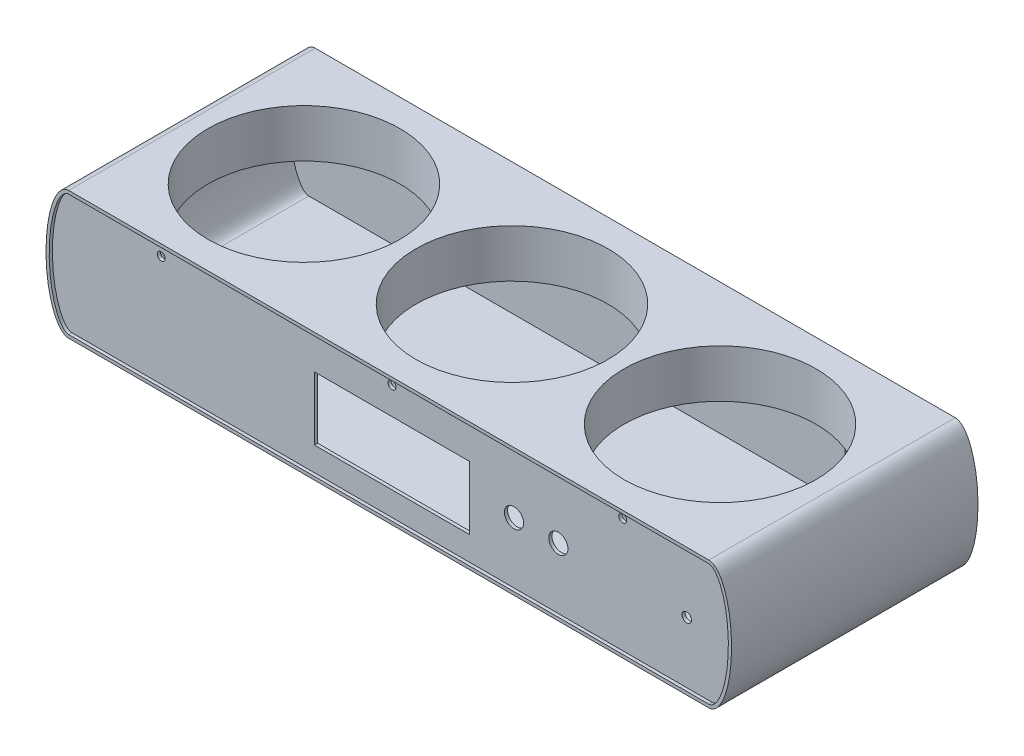
from build123d import *

# Parameters (mm, degrees)
BOSS_EXTRUDE1_DEPTH = 150
SHELL1_START        = -148
SHELL1_DEPTH        = 146
SKETCH2_R           = 6
SKETCH2_R_2         = 2.975
SKETCH2_R_3         = 2.5
SKETCH2_W           = 96.9
SKETCH2_H           = 39.6
CUT_EXTRUDE1_DEPTH  = 45
SKETCH5_R           = 60
CUT_EXTRUDE2_DEPTH  = 20
BOSS_EXTRUDE2_DEPTH = 2
SKETCH8_R           = 5.725
SKETCH8_R_2         = 2.5
SKETCH8_R_3         = 5.9
SKETCH8_W           = 18.5
SKETCH8_H           = 11.65
CUT_EXTRUDE3_DEPTH  = 11
SKETCH11_R          = 62
BOSS_EXTRUDE4_DEPTH = 30
SKETCH13_R          = 60
CUT_EXTRUDE4_DEPTH  = 45


# Read off the part's stored shape, not the designer's step: Shell1
with BuildPart() as part:
    # Sketch1 → Boss-Extrude1 (new body)
    with BuildSketch(Plane.XY):
        with BuildLine():
            Line((-41.816524499, 40.032801891), (358.183475501, 40.032801891))
            add(Edge.make_bspline(
                [(358.183475501, -39.967198109), (372.391507509, -39.967198109), (372.391507509, 0.032801891), (372.391507509, 40.032801891), (358.183475501, 40.032801891)],
                knots=[0, 0, 0, 1.570796327, 1.570796327, 3.141592654, 3.141592654, 3.141592654], degree=2, weights=[1, 0.707106781, 1, 0.707106781, 1]))
            Line((358.183475501, -39.967198109), (-41.816524499, -39.967198109))
            add(Edge.make_bspline(
                [(-41.816524499, 40.032801891), (-56.009616115, 40.032801891), (-56.009616115, 0.032801891), (-56.009616115, -39.967198109), (-41.816524499, -39.967198109)],
                knots=[3.141592654, 3.141592654, 3.141592654, 4.71238898, 4.71238898, 6.283185307, 6.283185307, 6.283185307], degree=2, weights=[1, 0.707106781, 1, 0.707106781, 1]))
        make_face()
    extrude(amount=-BOSS_EXTRUDE1_DEPTH)

    # Shell1 outline → Shell1 (cut)
    with BuildSketch(Plane.XY.offset(SHELL1_START)):
        with BuildLine():
            Line((358.183475501, 38.032801891), (-41.816524499, 38.032801891))
            add(Edge.make_bspline(
                [(-41.816524499, 38.032801891), (-42.29654564, 38.032801891), (-42.776546096, 37.951085494), (-43.280925698, 37.787492415), (-43.832219156, 37.527474208), (-44.444686696, 37.138196586), (-45.071592247, 36.595227373), (-45.720652169, 35.929204369), (-46.370016725, 35.109675392), (-47.015189306, 34.167959998), (-47.648934224, 33.092532674), (-48.265193972, 31.897866168), (-48.859695346, 30.587234727), (-49.428322074, 29.168368378), (-50.507065031, 26.128176752), (-51.017177006, 24.506864975), (-51.494619215, 22.791506954), (-51.936525781, 20.989584017), (-52.340446316, 19.108866555), (-52.704268982, 17.157395109), (-53.026178484, 15.14346074), (-53.304635505, 13.075581705), (-53.538367116, 10.962474671), (-53.726361406, 8.813020108), (-53.867862487, 6.636222674), (-53.96236573, 4.44116883), (-54.009616115, 2.236985115), (-54.009616115, -2.171381333), (-53.96236573, -4.375565048), (-53.867862487, -6.570618892), (-53.726361405, -8.747416326), (-53.538367116, -10.896870889), (-53.304635504, -13.009977923), (-53.026178485, -15.077856959), (-52.704268981, -17.091791327), (-52.340446316, -19.043262773), (-51.936525781, -20.923980234), (-51.494619216, -22.725903172), (-51.017177006, -24.441261193), (-50.507065031, -26.06257297), (-49.428322074, -29.102764596), (-48.859695346, -30.521630946), (-48.265193972, -31.832262386), (-47.648934225, -33.026928892), (-47.015189304, -34.102356215), (-46.370016727, -35.04407161), (-45.720652167, -35.863600586), (-45.071592248, -36.529623591), (-44.444686695, -37.072592804), (-43.832219156, -37.461870426), (-43.280925698, -37.721888633), (-42.776546096, -37.885481712), (-42.29654564, -37.967198109), (-41.816524499, -37.967198109)],
                knots=[3.141592654, 3.141592654, 3.141592654, 3.141592654, 3.141592654, 3.141592654, 3.141592654, 3.141592654, 3.141592654, 3.141592654, 3.141592654, 3.141592654, 3.141592654, 3.141592654, 3.141592654, 3.926990817, 3.926990817, 3.926990817, 3.926990817, 3.926990817, 3.926990817, 3.926990817, 3.926990817, 3.926990817, 3.926990817, 3.926990817, 3.926990817, 3.926990817, 4.71238898, 4.71238898, 4.71238898, 4.71238898, 4.71238898, 4.71238898, 4.71238898, 4.71238898, 4.71238898, 4.71238898, 4.71238898, 4.71238898, 4.71238898, 5.497787144, 5.497787144, 5.497787144, 5.497787144, 5.497787144, 5.497787144, 5.497787144, 5.497787144, 5.497787144, 5.497787144, 5.497787144, 5.497787144, 5.497787144, 6.283185307, 6.283185307, 6.283185307, 6.283185307, 6.283185307, 6.283185307, 6.283185307, 6.283185307, 6.283185307, 6.283185307, 6.283185307, 6.283185307, 6.283185307, 6.283185307, 6.283185307], degree=14))
            Line((-41.816524499, -37.967198109), (358.183475501, -37.967198109))
            add(Edge.make_bspline(
                [(358.183475501, -37.967198109), (358.664667304, -37.967198109), (359.145838532, -37.885368285), (359.651292917, -37.721551252), (360.203481604, -37.461253791), (360.816610656, -37.071839887), (361.444325063, -36.52883648), (362.094001303, -35.862723499), (362.744092434, -35.043248033), (363.389903897, -34.101515507), (364.02430687, -33.026135747), (364.641192661, -31.831501509), (365.236301097, -30.520914046), (365.805508254, -29.102092826), (366.885353654, -26.061994383), (367.395987588, -24.44073051), (367.873919198, -22.725420434), (368.31627955, -20.923544874), (368.720615505, -19.042873973), (369.084812855, -17.091448204), (369.407054219, -15.077558647), (369.68579858, -13.009723628), (369.919771534, -10.89665992), (370.107960052, -8.747248119), (370.249607364, -6.570493024), (370.344208283, -4.375481235), (370.391507509, -2.171339425), (370.391507509, 2.236943207), (370.344208282, 4.441085017), (370.249607366, 6.636096806), (370.107960046, 8.812851901), (369.919771543, 10.962263702), (369.685798567, 13.075327409), (369.407054233, 15.143162429), (369.084812843, 17.157051985), (368.720615514, 19.108477756), (368.316279545, 20.989148655), (367.8739192, 22.791024216), (367.395987587, 24.506334292), (366.885353654, 26.127598165), (365.805508254, 29.167696608), (365.236301097, 30.586517828), (364.641192661, 31.897105291), (364.024306871, 33.091739529), (363.389903896, 34.167119289), (362.744092436, 35.108851814), (362.0940013, 35.928327281), (361.444325066, 36.594440262), (360.816610654, 37.137443669), (360.203481606, 37.526857573), (359.651292916, 37.787155034), (359.145838532, 37.950972067), (358.664667304, 38.032801891), (358.183475501, 38.032801891)],
                knots=[0, 0, 0, 0, 0, 0, 0, 0, 0, 0, 0, 0, 0, 0, 0, 0.785398163, 0.785398163, 0.785398163, 0.785398163, 0.785398163, 0.785398163, 0.785398163, 0.785398163, 0.785398163, 0.785398163, 0.785398163, 0.785398163, 0.785398163, 1.570796327, 1.570796327, 1.570796327, 1.570796327, 1.570796327, 1.570796327, 1.570796327, 1.570796327, 1.570796327, 1.570796327, 1.570796327, 1.570796327, 1.570796327, 2.35619449, 2.35619449, 2.35619449, 2.35619449, 2.35619449, 2.35619449, 2.35619449, 2.35619449, 2.35619449, 2.35619449, 2.35619449, 2.35619449, 2.35619449, 3.141592654, 3.141592654, 3.141592654, 3.141592654, 3.141592654, 3.141592654, 3.141592654, 3.141592654, 3.141592654, 3.141592654, 3.141592654, 3.141592654, 3.141592654, 3.141592654, 3.141592654], degree=14))
        make_face()
    extrude(amount=SHELL1_DEPTH, mode=Mode.SUBTRACT)

    # Sketch2 → Cut-Extrude1 (cut)
    with BuildSketch(Plane.XY):
        with Locations((234.439498222, 0.059436575)):
            Circle(SKETCH2_R)
        with Locations((262.1475136, 0.059436575)):
            Circle(SKETCH2_R)
        with Locations((342.391504359, 0.059436575)):
            Circle(SKETCH2_R_2)
        with Locations((158.183475501, 33.772997638)):
            Circle(SKETCH2_R_3)
        with Locations((302.391504359, 33.772997638)):
            Circle(SKETCH2_R_3)
        with Locations((13.990387032, 31.272997638)):
            Circle(SKETCH2_R_3)
        with Locations((158.190945695, -3.167198109)):
            Rectangle(SKETCH2_W, SKETCH2_H)
    extrude(amount=-CUT_EXTRUDE1_DEPTH, mode=Mode.SUBTRACT)

    # Sketch5 → Cut-Extrude2 (cut)
    with BuildSketch(Plane(origin=(0, 40.032801891, 0), x_dir=(1, 0, 0), z_dir=(0, 1, 0))):
        with Locations(Location((158.183475501, 75, 0), (0, 0, 270))):
            Circle(SKETCH5_R)
        with Locations(Location((28.183475501, 75, 0), (0, 0, 270))):
            Circle(SKETCH5_R)
        with Locations(Location((288.183475501, 75, 0), (0, 0, 270))):
            Circle(SKETCH5_R)
    extrude(amount=-CUT_EXTRUDE2_DEPTH, mode=Mode.SUBTRACT)

    # Sketch7 → Boss-Extrude2 (add)
    with BuildSketch(Plane.XY):
        with BuildLine():
            Line((-41.816524499, 40.032801891), (358.183475501, 40.032801891))
            add(Edge.make_bspline(
                [(358.183475501, -39.967198109), (372.391507509, -39.967198109), (372.391507509, 0.032801891), (372.391507509, 40.032801891), (358.183475501, 40.032801891)],
                knots=[0, 0, 0, 1.570796327, 1.570796327, 3.141592654, 3.141592654, 3.141592654], degree=2, weights=[1, 0.707106781, 1, 0.707106781, 1]))
            Line((358.183475501, -39.967198109), (-41.816524499, -39.967198109))
            add(Edge.make_bspline(
                [(-41.816524499, 40.032801891), (-56.009616115, 40.032801891), (-56.009616115, 0.032801891), (-56.009616115, -39.967198109), (-41.816524499, -39.967198109)],
                knots=[3.141592654, 3.141592654, 3.141592654, 4.71238898, 4.71238898, 6.283185307, 6.283185307, 6.283185307], degree=2, weights=[1, 0.707106781, 1, 0.707106781, 1]))
        make_face()
        with BuildLine():
            Line((-41.816524499, 38.032801891), (358.183475501, 38.032801891))
            add(Edge.make_bspline(
                [(358.183475501, 38.032801891), (358.472329101, 38.032801891), (359.022971599, 37.957413461), (360.27410345, 37.45060729), (362.089990021, 35.945480673), (364.343703734, 32.582811471), (366.40153477, 27.840073609), (368.12274291, 21.942778412), (369.844369693, 12.887615075), (370.756266053, 0.032801891), (369.844369693, -12.822011293), (368.12274291, -21.87717463), (366.40153477, -27.774469827), (364.343703734, -32.517207689), (362.089990021, -35.879876891), (360.27410345, -37.385003508), (359.022971599, -37.891809679), (358.472329101, -37.967198109), (358.183475501, -37.967198109)],
                knots=[0, 0, 0, 0, 0.09817477, 0.196349541, 0.392699082, 0.589048623, 0.785398163, 0.981747704, 1.178097245, 1.570796327, 1.963495408, 2.159844949, 2.35619449, 2.552544031, 2.748893572, 2.945243113, 3.043417883, 3.141592654, 3.141592654, 3.141592654, 3.141592654], degree=3))
            Line((358.183475501, -37.967198109), (-41.816524499, -37.967198109))
            add(Edge.make_bspline(
                [(-41.816524499, -37.967198109), (-42.104715544, -37.967198109), (-42.653968338, -37.891927551), (-43.902844986, -37.385573403), (-45.716604755, -35.880737362), (-47.968007616, -32.517990614), (-50.023741387, -27.775097295), (-51.74318815, -21.877632905), (-53.463044087, -12.822256118), (-54.373997467, 0.032801891), (-53.463044087, 12.8878599), (-51.74318815, 21.943236687), (-50.023741387, 27.840701077), (-47.968007616, 32.583594396), (-45.716604755, 35.946341144), (-43.902844986, 37.451177185), (-42.653968338, 37.957531333), (-42.104715544, 38.032801891), (-41.816524499, 38.032801891)],
                knots=[3.141592654, 3.141592654, 3.141592654, 3.141592654, 3.239767424, 3.337942194, 3.534291735, 3.730641276, 3.926990817, 4.123340358, 4.319689899, 4.71238898, 5.105088062, 5.301437603, 5.497787144, 5.694136685, 5.890486225, 6.086835766, 6.185010537, 6.283185307, 6.283185307, 6.283185307, 6.283185307], degree=3))
        make_face(mode=Mode.SUBTRACT)
    boss_extrude2 = extrude(amount=BOSS_EXTRUDE2_DEPTH)

    # Mirror1: Boss-Extrude2 across plane
    add(boss_extrude2.mirror(Plane.XY.offset(-75)))

    # Sketch8 → Cut-Extrude3 (cut)
    with BuildSketch(Plane(origin=(0, 0, -150), x_dir=(-1, 0, 0), z_dir=(0, 0, -1))):
        with Locations((-321.200059194, -9.859981839)):
            Circle(SKETCH8_R)
        with Locations((-302.373579538, 1.030580014)):
            Circle(SKETCH8_R_2)
        with Locations((21.523507198, 0.032801891)):
            Circle(SKETCH8_R_3)
        with Locations((-302.373579538, -10.059514328)):
            Rectangle(SKETCH8_W, SKETCH8_H)
    extrude(amount=-CUT_EXTRUDE3_DEPTH, mode=Mode.SUBTRACT)

    # Sketch11 → Boss-Extrude4 (add)
    with BuildSketch(Plane(origin=(0, 40.032801891, 0), x_dir=(1, 0, 0), z_dir=(0, 1, 0))):
        with Locations(Location((28.183475501, 75, 0), (0, 0, 270))):
            Circle(SKETCH11_R)
        with Locations(Location((158.183475501, 75, 0), (0, 0, 270))):
            Circle(SKETCH11_R)
        with Locations(Location((288.183475501, 75, 0), (0, 0, 270))):
            Circle(SKETCH11_R)
    extrude(amount=-BOSS_EXTRUDE4_DEPTH)

    # Sketch13 → Cut-Extrude4 (cut)
    with BuildSketch(Plane(origin=(0, 40.032801891, 0), x_dir=(1, 0, 0), z_dir=(0, 1, 0))):
        with Locations(Location((28.183475501, 75, 0), (0, 0, 270))):
            Circle(SKETCH13_R)
        with Locations(Location((158.183475501, 75, 0), (0, 0, 270))):
            Circle(SKETCH13_R)
        with Locations(Location((288.183475501, 75, 0), (0, 0, 270))):
            Circle(SKETCH13_R)
    extrude(amount=-CUT_EXTRUDE4_DEPTH, mode=Mode.SUBTRACT)


solid = part.part
